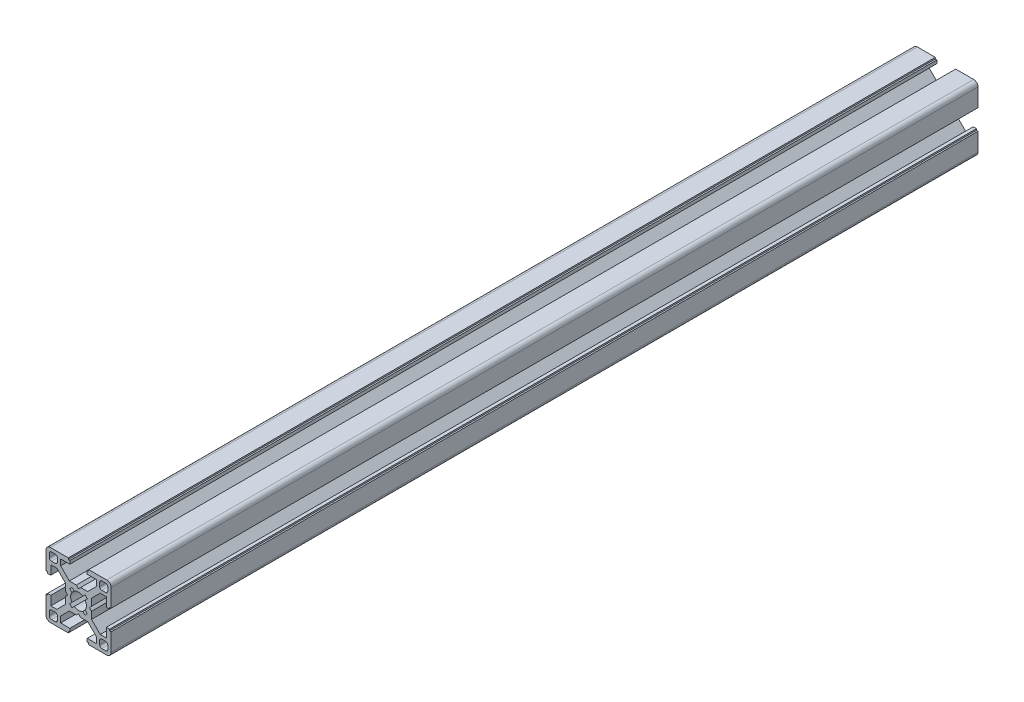
from build123d import *

# Parameters (mm, degrees)
ESTRUSIONE_ESTRUSIONE2_DEPTH = 400


with BuildPart() as part:
    # Schizzo1 → Estrusione-Estrusione2 (new body)
    with BuildSketch(Plane.XY):
        with BuildLine():
            ThreePointArc((-13, 15), (-14.414213562, 14.414213562), (-15, 13))
            Line((-15, 13), (-15, 4.7))
            Line((-15, 4.7), (-14.3, 4.7))
            Line((-14.3, 4.7), (-14.3, 4))
            Line((-14.3, 4), (-12.8, 4))
            Line((-12.8, 4), (-12.8, 8.25))
            Line((-12.8, 8.25), (-10.017766953, 8.25))
            Line((-10.017766953, 8.25), (-6, 4.232233047))
            Line((-6, 4.232233047), (-6, 1))
            Line((-6, 1), (-5, 0))
            Line((-5, 0), (-6, -1))
            Line((-6, -1), (-6, -4.232233047))
            Line((-6, -4.232233047), (-10.017766953, -8.25))
            Line((-10.017766953, -8.25), (-12.8, -8.25))
            Line((-12.8, -8.25), (-12.8, -4))
            Line((-12.8, -4), (-14.3, -4))
            Line((-14.3, -4), (-14.3, -4.7))
            Line((-14.3, -4.7), (-15, -4.7))
            Line((-15, -4.7), (-15, -13))
            ThreePointArc((-15, -13), (-14.414213562, -14.414213562), (-13, -15))
            Line((-13, -15), (-4.7, -15))
            Line((-4.7, -15), (-4.7, -14.3))
            Line((-4.7, -14.3), (-4, -14.3))
            Line((-4, -14.3), (-4, -12.8))
            Line((-4, -12.8), (-8.25, -12.8))
            Line((-8.25, -12.8), (-8.25, -10.017766953))
            Line((-8.25, -10.017766953), (-4.232233047, -6))
            Line((-4.232233047, -6), (-1, -6))
            Line((-1, -6), (0, -5))
            Line((0, -5), (1, -6))
            Line((1, -6), (4.232233047, -6))
            Line((4.232233047, -6), (8.25, -10.017766953))
            Line((8.25, -10.017766953), (8.25, -12.8))
            Line((8.25, -12.8), (4, -12.8))
            Line((4, -12.8), (4, -14.3))
            Line((4, -14.3), (4.7, -14.3))
            Line((4.7, -14.3), (4.7, -15))
            Line((4.7, -15), (13, -15))
            ThreePointArc((13, -15), (14.414213562, -14.414213562), (15, -13))
            Line((15, -13), (15, -4.7))
            Line((15, -4.7), (14.3, -4.7))
            Line((14.3, -4.7), (14.3, -4))
            Line((14.3, -4), (12.8, -4))
            Line((12.8, -4), (12.8, -8.25))
            Line((12.8, -8.25), (10.017766953, -8.25))
            Line((10.017766953, -8.25), (6, -4.232233047))
            Line((6, -4.232233047), (6, -1))
            Line((6, -1), (5, 0))
            Line((5, 0), (6, 1))
            Line((6, 1), (6, 4.232233047))
            Line((6, 4.232233047), (10.017766953, 8.25))
            Line((10.017766953, 8.25), (12.8, 8.25))
            Line((12.8, 8.25), (12.8, 4))
            Line((12.8, 4), (14.3, 4))
            Line((14.3, 4), (14.3, 4.7))
            Line((14.3, 4.7), (15, 4.7))
            Line((15, 4.7), (15, 13))
            ThreePointArc((15, 13), (14.414213562, 14.414213562), (13, 15))
            Line((13, 15), (4.7, 15))
            Line((4.7, 15), (4.7, 14.3))
            Line((4.7, 14.3), (4, 14.3))
            Line((4, 14.3), (4, 12.8))
            Line((4, 12.8), (8.25, 12.8))
            Line((8.25, 12.8), (8.25, 10.017766953))
            Line((8.25, 10.017766953), (4.232233047, 6))
            Line((4.232233047, 6), (1, 6))
            Line((1, 6), (0, 5))
            Line((0, 5), (-1, 6))
            Line((-1, 6), (-4.232233047, 6))
            Line((-4.232233047, 6), (-8.25, 10.017766953))
            Line((-8.25, 10.017766953), (-8.25, 12.8))
            Line((-8.25, 12.8), (-4, 12.8))
            Line((-4, 12.8), (-4, 14.3))
            Line((-4, 14.3), (-4.7, 14.3))
            Line((-4.7, 14.3), (-4.7, 15))
            Line((-4.7, 15), (-13, 15))
        make_face()
        with BuildLine():
            Line((-13.5, -12.5), (-13.5, -10.75))
            ThreePointArc((-13.5, -10.75), (-13.207106781, -10.042893219), (-12.5, -9.75))
            Line((-12.5, -9.75), (-10.75, -9.75))
            ThreePointArc((-10.75, -9.75), (-10.042893219, -10.042893219), (-9.75, -10.75))
            Line((-9.75, -10.75), (-9.75, -12.5))
            ThreePointArc((-9.75, -12.5), (-10.042893219, -13.207106781), (-10.75, -13.5))
            Line((-10.75, -13.5), (-12.5, -13.5))
            ThreePointArc((-12.5, -13.5), (-13.207106781, -13.207106781), (-13.5, -12.5))
        make_face(mode=Mode.SUBTRACT)
        with BuildLine():
            Line((12.5, -13.5), (10.75, -13.5))
            ThreePointArc((10.75, -13.5), (10.042893219, -13.207106781), (9.75, -12.5))
            Line((9.75, -12.5), (9.75, -10.75))
            ThreePointArc((9.75, -10.75), (10.042893219, -10.042893219), (10.75, -9.75))
            Line((10.75, -9.75), (12.5, -9.75))
            ThreePointArc((12.5, -9.75), (13.207106781, -10.042893219), (13.5, -10.75))
            Line((13.5, -10.75), (13.5, -12.5))
            ThreePointArc((13.5, -12.5), (13.207106781, -13.207106781), (12.5, -13.5))
        make_face(mode=Mode.SUBTRACT)
        with BuildLine():
            ThreePointArc((-9.75, 10.75), (-10.042893219, 10.042893219), (-10.75, 9.75))
            Line((-10.75, 9.75), (-12.5, 9.75))
            ThreePointArc((-12.5, 9.75), (-13.207106781, 10.042893219), (-13.5, 10.75))
            Line((-13.5, 10.75), (-13.5, 12.5))
            ThreePointArc((-13.5, 12.5), (-13.207106781, 13.207106781), (-12.5, 13.5))
            Line((-12.5, 13.5), (-10.75, 13.5))
            ThreePointArc((-10.75, 13.5), (-10.042893219, 13.207106781), (-9.75, 12.5))
            Line((-9.75, 12.5), (-9.75, 10.75))
        make_face(mode=Mode.SUBTRACT)
        with BuildLine():
            ThreePointArc((0, 3.65), (1.041005187, 3.498400806), (1.995536102, 3.056196274))
            Line((1.995536102, 3.056196274), (3.00520382, 4.065863992))
            Line((3.00520382, 4.065863992), (4.065863992, 3.00520382))
            Line((4.065863992, 3.00520382), (3.056196274, 1.995536102))
            ThreePointArc((3.056196274, 1.995536102), (3.498400806, 1.041005187), (3.65, 0))
            ThreePointArc((3.65, 0), (3.498400806, -1.041005187), (3.056196274, -1.995536102))
            Line((3.056196274, -1.995536102), (4.065863992, -3.00520382))
            Line((4.065863992, -3.00520382), (3.00520382, -4.065863992))
            Line((3.00520382, -4.065863992), (1.995536102, -3.056196274))
            ThreePointArc((1.995536102, -3.056196274), (1.041005187, -3.498400806), (0, -3.65))
            ThreePointArc((0, -3.65), (-1.041005187, -3.498400806), (-1.995536102, -3.056196274))
            Line((-1.995536102, -3.056196274), (-3.00520382, -4.065863992))
            Line((-3.00520382, -4.065863992), (-4.065863992, -3.00520382))
            Line((-4.065863992, -3.00520382), (-3.056196274, -1.995536102))
            ThreePointArc((-3.056196274, -1.995536102), (-3.498400806, -1.041005187), (-3.65, 0))
            ThreePointArc((-3.65, 0), (-3.498400806, 1.041005187), (-3.056196274, 1.995536102))
            Line((-3.056196274, 1.995536102), (-4.065863992, 3.00520382))
            Line((-4.065863992, 3.00520382), (-3.00520382, 4.065863992))
            Line((-3.00520382, 4.065863992), (-1.995536102, 3.056196274))
            ThreePointArc((-1.995536102, 3.056196274), (-1.041005187, 3.498400806), (0, 3.65))
        make_face(mode=Mode.SUBTRACT)
        with BuildLine():
            Line((13.5, 12.5), (13.5, 10.75))
            ThreePointArc((13.5, 10.75), (13.207106781, 10.042893219), (12.5, 9.75))
            Line((12.5, 9.75), (10.75, 9.75))
            ThreePointArc((10.75, 9.75), (10.042893219, 10.042893219), (9.75, 10.75))
            Line((9.75, 10.75), (9.75, 12.5))
            ThreePointArc((9.75, 12.5), (10.042893219, 13.207106781), (10.75, 13.5))
            Line((10.75, 13.5), (12.5, 13.5))
            ThreePointArc((12.5, 13.5), (13.207106781, 13.207106781), (13.5, 12.5))
        make_face(mode=Mode.SUBTRACT)
    extrude(amount=ESTRUSIONE_ESTRUSIONE2_DEPTH)


solid = part.part
